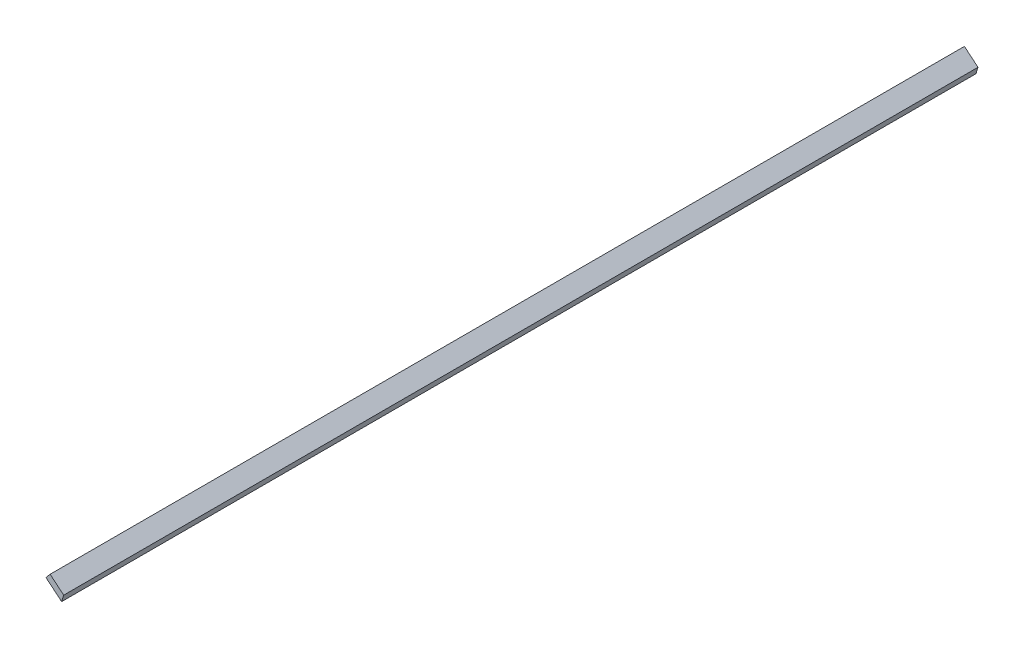
from build123d import *

# Parameters (mm, degrees)
BOSS_EXTRUDE1_DEPTH = 901.7


with BuildPart() as part:
    # Sketch1 → Boss-Extrude1 (new body)
    with BuildSketch(Plane.XY):
        Polygon((0, 0), (2.044356691, 6.562114978), (-11.350485362, 17.723807098), (-15.415510947, 12.845480848), align=None)
    extrude(amount=BOSS_EXTRUDE1_DEPTH)


solid = part.part
